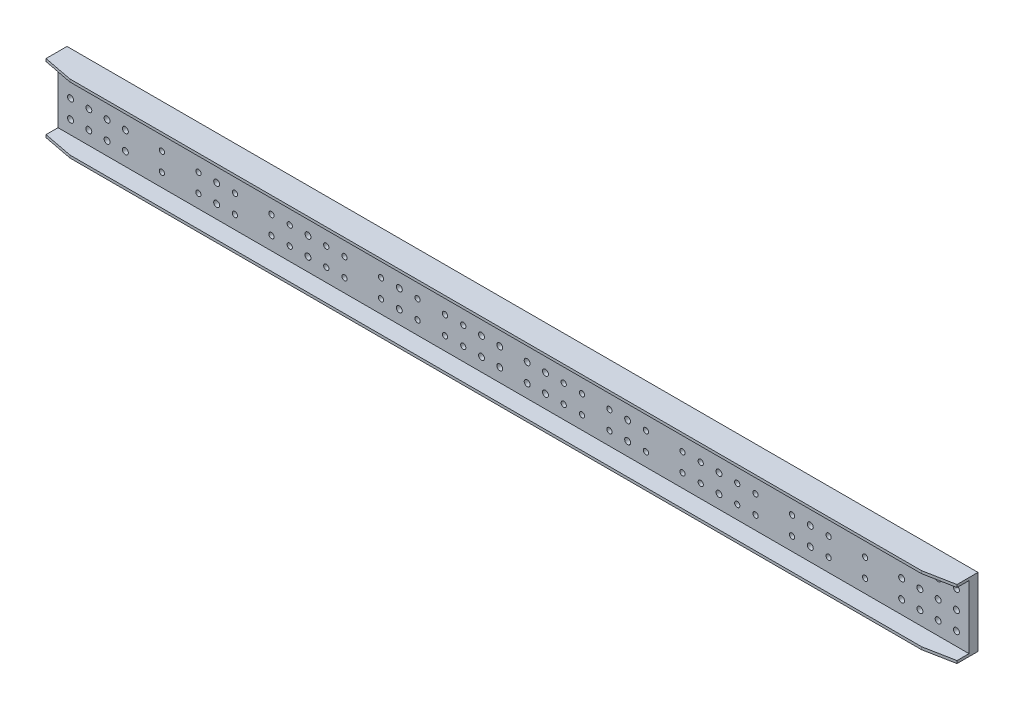
from build123d import *

# Parameters (mm, degrees)
SKETCH_1_W          = 3990
SKETCH_1_H          = 300
SKETCH_1_R          = 13
SKETCH_1_R_2        = 11.5
EXTRUDE_1540_DEPTH  = 39.5
SKETCH_2_W          = 3990
SKETCH_2_H          = 11.5
EXTRUDE_1_DEPTH     = 77.5
SKETCH_3_W          = 70
SKETCH_3_H          = 230
EXTRUDE_2_DEPTH     = 16
SKETCH_4_R          = 13
CUT_EXTRUDE_1_DEPTH = 2003.131676489
CUT_EXTRUDE_2_DEPTH = 2021.820130541


with BuildPart() as part:
    # 草图1 → Extrude 1540 (new body)
    with BuildSketch(Plane.XY):
        Rectangle(SKETCH_1_W, SKETCH_1_H)
        with Locations((1940, 80)):
            Circle(SKETCH_1_R, mode=Mode.SUBTRACT)
        with Locations((1860, 80)):
            Circle(SKETCH_1_R, mode=Mode.SUBTRACT)
        with Locations((1780, 80)):
            Circle(SKETCH_1_R, mode=Mode.SUBTRACT)
        with Locations((1700, 80)):
            Circle(SKETCH_1_R, mode=Mode.SUBTRACT)
        with Locations((1540, 80)):
            Circle(SKETCH_1_R_2, mode=Mode.SUBTRACT)
        with Locations((1380, 80)):
            Circle(SKETCH_1_R_2, mode=Mode.SUBTRACT)
        with Locations((1220, 80)):
            Circle(SKETCH_1_R_2, mode=Mode.SUBTRACT)
        with Locations((1060, 80)):
            Circle(SKETCH_1_R_2, mode=Mode.SUBTRACT)
        with Locations((980, 80)):
            Circle(SKETCH_1_R_2, mode=Mode.SUBTRACT)
        with Locations((820, 80)):
            Circle(SKETCH_1_R_2, mode=Mode.SUBTRACT)
        with Locations((740, 80)):
            Circle(SKETCH_1_R_2, mode=Mode.SUBTRACT)
        with Locations((580, 80)):
            Circle(SKETCH_1_R_2, mode=Mode.SUBTRACT)
        with Locations((980, 0)):
            Circle(SKETCH_1_R_2, mode=Mode.SUBTRACT)
        with Locations((1060, 0)):
            Circle(SKETCH_1_R_2, mode=Mode.SUBTRACT)
        with Locations((820, 0)):
            Circle(SKETCH_1_R_2, mode=Mode.SUBTRACT)
        with Locations((740, 0)):
            Circle(SKETCH_1_R_2, mode=Mode.SUBTRACT)
        with Locations((580, 0)):
            Circle(SKETCH_1_R_2, mode=Mode.SUBTRACT)
        with Locations((1220, 0)):
            Circle(SKETCH_1_R_2, mode=Mode.SUBTRACT)
        with Locations((1380, 0)):
            Circle(SKETCH_1_R_2, mode=Mode.SUBTRACT)
        with Locations((1540, 0)):
            Circle(SKETCH_1_R_2, mode=Mode.SUBTRACT)
        with Locations((1700, 0)):
            Circle(SKETCH_1_R, mode=Mode.SUBTRACT)
        with Locations((1780, 0)):
            Circle(SKETCH_1_R, mode=Mode.SUBTRACT)
        with Locations((1860, 0)):
            Circle(SKETCH_1_R, mode=Mode.SUBTRACT)
        with Locations((1940, 0)):
            Circle(SKETCH_1_R, mode=Mode.SUBTRACT)
        with Locations((420, 80)):
            Circle(SKETCH_1_R_2, mode=Mode.SUBTRACT)
        with Locations((420, 0)):
            Circle(SKETCH_1_R_2, mode=Mode.SUBTRACT)
        with Locations((300, 0)):
            Circle(SKETCH_1_R_2, mode=Mode.SUBTRACT)
        with Locations((300, 80)):
            Circle(SKETCH_1_R_2, mode=Mode.SUBTRACT)
        with Locations((220, 80)):
            Circle(SKETCH_1_R_2, mode=Mode.SUBTRACT)
        with Locations((220, 0)):
            Circle(SKETCH_1_R_2, mode=Mode.SUBTRACT)
        with Locations((140, 0)):
            Circle(SKETCH_1_R, mode=Mode.SUBTRACT)
        with Locations((140, 80)):
            Circle(SKETCH_1_R, mode=Mode.SUBTRACT)
        with Locations((60, 80)):
            Circle(SKETCH_1_R, mode=Mode.SUBTRACT)
        with Locations((60, 0)):
            Circle(SKETCH_1_R, mode=Mode.SUBTRACT)
        with Locations((1700, -80)):
            Circle(SKETCH_1_R, mode=Mode.SUBTRACT)
        with Locations((1780, -80)):
            Circle(SKETCH_1_R, mode=Mode.SUBTRACT)
        with Locations((1860, -80)):
            Circle(SKETCH_1_R, mode=Mode.SUBTRACT)
        with Locations((1940, -80)):
            Circle(SKETCH_1_R, mode=Mode.SUBTRACT)
        with Locations((580, -80)):
            Circle(SKETCH_1_R_2, mode=Mode.SUBTRACT)
        with Locations((740, -80)):
            Circle(SKETCH_1_R_2, mode=Mode.SUBTRACT)
        with Locations((820, -80)):
            Circle(SKETCH_1_R_2, mode=Mode.SUBTRACT)
        with Locations((980, -80)):
            Circle(SKETCH_1_R_2, mode=Mode.SUBTRACT)
        with Locations((1060, -80)):
            Circle(SKETCH_1_R_2, mode=Mode.SUBTRACT)
        with Locations((1220, -80)):
            Circle(SKETCH_1_R_2, mode=Mode.SUBTRACT)
        with Locations((1380, -80)):
            Circle(SKETCH_1_R_2, mode=Mode.SUBTRACT)
        with Locations((1540, -80)):
            Circle(SKETCH_1_R_2, mode=Mode.SUBTRACT)
        with Locations((220, -80)):
            Circle(SKETCH_1_R_2, mode=Mode.SUBTRACT)
        with Locations((300, -80)):
            Circle(SKETCH_1_R_2, mode=Mode.SUBTRACT)
        with Locations((420, -80)):
            Circle(SKETCH_1_R_2, mode=Mode.SUBTRACT)
        with Locations((60, -80)):
            Circle(SKETCH_1_R, mode=Mode.SUBTRACT)
        with Locations((140, -80)):
            Circle(SKETCH_1_R, mode=Mode.SUBTRACT)
        with Locations((-140, -80)):
            Circle(SKETCH_1_R, mode=Mode.SUBTRACT)
        with Locations((-60, -80)):
            Circle(SKETCH_1_R, mode=Mode.SUBTRACT)
        with Locations((-580, -80)):
            Circle(SKETCH_1_R_2, mode=Mode.SUBTRACT)
        with Locations((-420, -80)):
            Circle(SKETCH_1_R_2, mode=Mode.SUBTRACT)
        with Locations((-300, -80)):
            Circle(SKETCH_1_R_2, mode=Mode.SUBTRACT)
        with Locations((-220, -80)):
            Circle(SKETCH_1_R_2, mode=Mode.SUBTRACT)
        with Locations((-1540, -80)):
            Circle(SKETCH_1_R_2, mode=Mode.SUBTRACT)
        with Locations((-1380, -80)):
            Circle(SKETCH_1_R_2, mode=Mode.SUBTRACT)
        with Locations((-1220, -80)):
            Circle(SKETCH_1_R_2, mode=Mode.SUBTRACT)
        with Locations((-1060, -80)):
            Circle(SKETCH_1_R_2, mode=Mode.SUBTRACT)
        with Locations((-980, -80)):
            Circle(SKETCH_1_R_2, mode=Mode.SUBTRACT)
        with Locations((-820, -80)):
            Circle(SKETCH_1_R_2, mode=Mode.SUBTRACT)
        with Locations((-740, -80)):
            Circle(SKETCH_1_R_2, mode=Mode.SUBTRACT)
        with Locations((-1940, -80)):
            Circle(SKETCH_1_R, mode=Mode.SUBTRACT)
        with Locations((-1860, -80)):
            Circle(SKETCH_1_R, mode=Mode.SUBTRACT)
        with Locations((-1780, -80)):
            Circle(SKETCH_1_R, mode=Mode.SUBTRACT)
        with Locations((-1700, -80)):
            Circle(SKETCH_1_R, mode=Mode.SUBTRACT)
        with Locations((-60, 0)):
            Circle(SKETCH_1_R, mode=Mode.SUBTRACT)
        with Locations((-60, 80)):
            Circle(SKETCH_1_R, mode=Mode.SUBTRACT)
        with Locations((-140, 80)):
            Circle(SKETCH_1_R, mode=Mode.SUBTRACT)
        with Locations((-140, 0)):
            Circle(SKETCH_1_R, mode=Mode.SUBTRACT)
        with Locations((-220, 0)):
            Circle(SKETCH_1_R_2, mode=Mode.SUBTRACT)
        with Locations((-220, 80)):
            Circle(SKETCH_1_R_2, mode=Mode.SUBTRACT)
        with Locations((-300, 80)):
            Circle(SKETCH_1_R_2, mode=Mode.SUBTRACT)
        with Locations((-300, 0)):
            Circle(SKETCH_1_R_2, mode=Mode.SUBTRACT)
        with Locations((-420, 0)):
            Circle(SKETCH_1_R_2, mode=Mode.SUBTRACT)
        with Locations((-420, 80)):
            Circle(SKETCH_1_R_2, mode=Mode.SUBTRACT)
        with Locations((-1940, 0)):
            Circle(SKETCH_1_R, mode=Mode.SUBTRACT)
        with Locations((-1860, 0)):
            Circle(SKETCH_1_R, mode=Mode.SUBTRACT)
        with Locations((-1780, 0)):
            Circle(SKETCH_1_R, mode=Mode.SUBTRACT)
        with Locations((-1700, 0)):
            Circle(SKETCH_1_R, mode=Mode.SUBTRACT)
        with Locations((-1540, 0)):
            Circle(SKETCH_1_R_2, mode=Mode.SUBTRACT)
        with Locations((-1380, 0)):
            Circle(SKETCH_1_R_2, mode=Mode.SUBTRACT)
        with Locations((-1220, 0)):
            Circle(SKETCH_1_R_2, mode=Mode.SUBTRACT)
        with Locations((-580, 0)):
            Circle(SKETCH_1_R_2, mode=Mode.SUBTRACT)
        with Locations((-740, 0)):
            Circle(SKETCH_1_R_2, mode=Mode.SUBTRACT)
        with Locations((-820, 0)):
            Circle(SKETCH_1_R_2, mode=Mode.SUBTRACT)
        with Locations((-1060, 0)):
            Circle(SKETCH_1_R_2, mode=Mode.SUBTRACT)
        with Locations((-980, 0)):
            Circle(SKETCH_1_R_2, mode=Mode.SUBTRACT)
        with Locations((-580, 80)):
            Circle(SKETCH_1_R_2, mode=Mode.SUBTRACT)
        with Locations((-740, 80)):
            Circle(SKETCH_1_R_2, mode=Mode.SUBTRACT)
        with Locations((-820, 80)):
            Circle(SKETCH_1_R_2, mode=Mode.SUBTRACT)
        with Locations((-980, 80)):
            Circle(SKETCH_1_R_2, mode=Mode.SUBTRACT)
        with Locations((-1060, 80)):
            Circle(SKETCH_1_R_2, mode=Mode.SUBTRACT)
        with Locations((-1220, 80)):
            Circle(SKETCH_1_R_2, mode=Mode.SUBTRACT)
        with Locations((-1380, 80)):
            Circle(SKETCH_1_R_2, mode=Mode.SUBTRACT)
        with Locations((-1540, 80)):
            Circle(SKETCH_1_R_2, mode=Mode.SUBTRACT)
        with Locations((-1700, 80)):
            Circle(SKETCH_1_R, mode=Mode.SUBTRACT)
        with Locations((-1780, 80)):
            Circle(SKETCH_1_R, mode=Mode.SUBTRACT)
        with Locations((-1860, 80)):
            Circle(SKETCH_1_R, mode=Mode.SUBTRACT)
        with Locations((-1940, 80)):
            Circle(SKETCH_1_R, mode=Mode.SUBTRACT)
    extrude(amount=EXTRUDE_1540_DEPTH)

    # 草图2 → 凸台-拉伸1 (add)
    with BuildSketch(Plane.XY.offset(39.5)):
        with Locations((0, 144.25)):
            Rectangle(SKETCH_2_W, SKETCH_2_H)
        with Locations((0, -144.25)):
            Rectangle(SKETCH_2_W, SKETCH_2_H)
    extrude(amount=EXTRUDE_1_DEPTH)

    # 草图3 → 凸台-拉伸2 (add)
    with BuildSketch(Plane(origin=(0, 0, 0), x_dir=(-1, 0, 0), z_dir=(0, 0, -1))):
        with Locations((1300, 0)):
            Rectangle(SKETCH_3_W, SKETCH_3_H)
        with Locations((900, 0)):
            Rectangle(SKETCH_3_W, SKETCH_3_H)
        with Locations((-1300, 0)):
            Rectangle(SKETCH_3_W, SKETCH_3_H)
        with Locations((500, 0)):
            Rectangle(SKETCH_3_W, SKETCH_3_H)
        with Locations((-900, 0)):
            Rectangle(SKETCH_3_W, SKETCH_3_H)
        with Locations((-500, 0)):
            Rectangle(SKETCH_3_W, SKETCH_3_H)
    extrude(amount=EXTRUDE_2_DEPTH)

    # 草图4 → 切除-拉伸1 (cut, through all)
    with BuildSketch(Plane.XY.offset(39.5)):
        with Locations((1300, 80)):
            Circle(SKETCH_4_R)
        with Locations((900, 80)):
            Circle(SKETCH_4_R)
        with Locations((900, 0)):
            Circle(SKETCH_4_R)
        with Locations((1300, 0)):
            Circle(SKETCH_4_R)
        with Locations((900, -80)):
            Circle(SKETCH_4_R)
        with Locations((1300, -80)):
            Circle(SKETCH_4_R)
        with Locations((500, 80)):
            Circle(SKETCH_4_R)
        with Locations((500, 0)):
            Circle(SKETCH_4_R)
        with Locations((500, -80)):
            Circle(SKETCH_4_R)
        with Locations((-500, -80)):
            Circle(SKETCH_4_R)
        with Locations((-500, 0)):
            Circle(SKETCH_4_R)
        with Locations((-500, 80)):
            Circle(SKETCH_4_R)
        with Locations((-1300, -80)):
            Circle(SKETCH_4_R)
        with Locations((-900, -80)):
            Circle(SKETCH_4_R)
        with Locations((-1300, 0)):
            Circle(SKETCH_4_R)
        with Locations((-900, 0)):
            Circle(SKETCH_4_R)
        with Locations((-900, 80)):
            Circle(SKETCH_4_R)
        with Locations((-1300, 80)):
            Circle(SKETCH_4_R)
    extrude(amount=-CUT_EXTRUDE_1_DEPTH, mode=Mode.SUBTRACT)

    # 草图5 → 切除-拉伸2 (cut, through all)
    with BuildSketch(Plane(origin=(0, 150, 0), x_dir=(-1, 0, 0), z_dir=(0, 1, 0))):
        Polygon((-1995, 92), (-1995, 117), (-1865, 117), align=None)
        Polygon((1865, 117), (1995, 92), (1995, 117), align=None)
    extrude(amount=-CUT_EXTRUDE_2_DEPTH, mode=Mode.SUBTRACT)


solid = part.part
